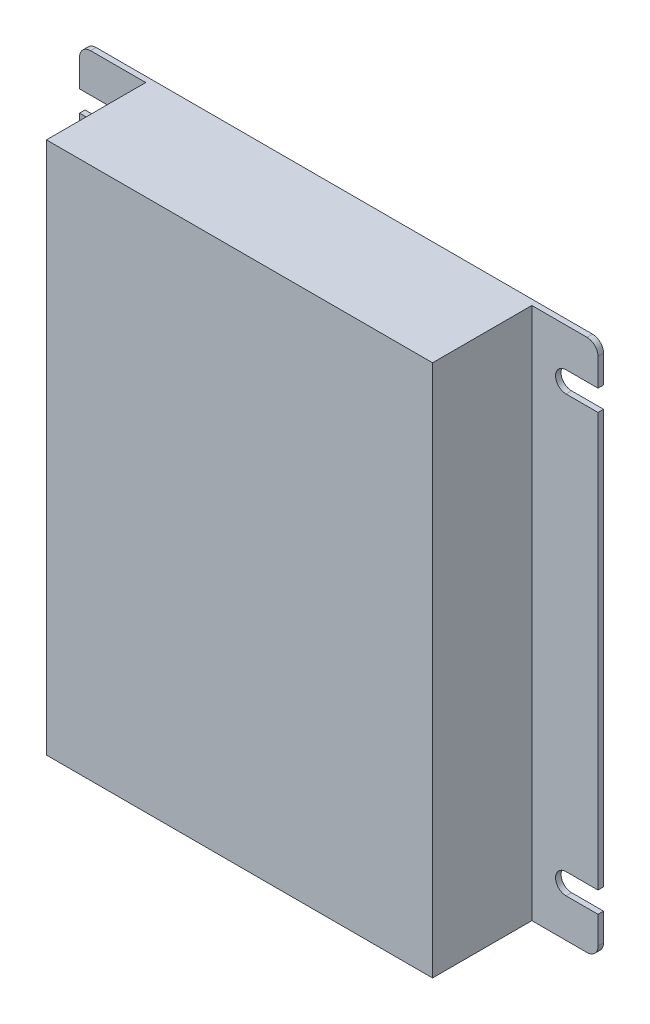
from build123d import *

# Parameters (mm, degrees)
SKETCH1_W           = 119.38
SKETCH1_H           = 122.682
BOSS_EXTRUDE1_DEPTH = 24.13
SKETCH2_W           = 15.24
SKETCH2_H           = 22.86
CUT_EXTRUDE1_DEPTH  = 139.549724374
CUT_EXTRUDE2_DEPTH  = 89.590033192
FILLET1_R           = 2.54


with BuildPart() as part:
    # Sketch1 → Boss-Extrude1 (new body)
    with BuildSketch(Plane.XY):
        Rectangle(SKETCH1_W, SKETCH1_H)
    extrude(amount=BOSS_EXTRUDE1_DEPTH)

    # Sketch2 → Cut-Extrude1 (cut, through all)
    with BuildSketch(Plane.XZ.offset(61.341)):
        with Locations((52.07, 12.7)):
            Rectangle(SKETCH2_W, SKETCH2_H)
        with Locations((-52.07, 12.7)):
            Rectangle(SKETCH2_W, SKETCH2_H)
    extrude(amount=-CUT_EXTRUDE1_DEPTH, mode=Mode.SUBTRACT)

    # Sketch3 → Cut-Extrude2 (cut, through all)
    with BuildSketch(Plane.XY.offset(1.27)):
        with BuildLine():
            Line((-59.69, 52.451), (-52.324, 52.451))
            ThreePointArc((-52.324, 52.451), (-49.911, 50.038), (-52.324, 47.625))
            Line((-52.324, 47.625), (-59.69, 47.625))
            ThreePointArc((-59.69, 47.625), (-62.103, 50.038), (-59.69, 52.451))
        make_face()
        with BuildLine():
            Line((-59.69, -47.625), (-52.324, -47.625))
            ThreePointArc((-52.324, -47.625), (-49.911, -50.038), (-52.324, -52.451))
            Line((-52.324, -52.451), (-59.69, -52.451))
            ThreePointArc((-59.69, -52.451), (-62.103, -50.038), (-59.69, -47.625))
        make_face()
        with BuildLine():
            Line((59.69, -52.451), (52.324, -52.451))
            ThreePointArc((52.324, -52.451), (49.911, -50.038), (52.324, -47.625))
            Line((52.324, -47.625), (59.69, -47.625))
            ThreePointArc((59.69, -47.625), (62.103, -50.038), (59.69, -52.451))
        make_face()
        with BuildLine():
            Line((59.69, 47.625), (52.324, 47.625))
            ThreePointArc((52.324, 47.625), (49.911, 50.038), (52.324, 52.451))
            Line((52.324, 52.451), (59.69, 52.451))
            ThreePointArc((59.69, 52.451), (62.103, 50.038), (59.69, 47.625))
        make_face()
    extrude(amount=-CUT_EXTRUDE2_DEPTH, mode=Mode.SUBTRACT)

    # Fillet1
    fillet1_edges = [part.edges().sort_by_distance(p)[0] for p in [
        (-59.69, 61.341, 0.635),
        (-59.69, -61.341, 0.635),
        (59.69, -61.341, 0.635),
        (59.69, 61.341, 0.635),
    ]]
    fillet(fillet1_edges, radius=FILLET1_R)


solid = part.part
